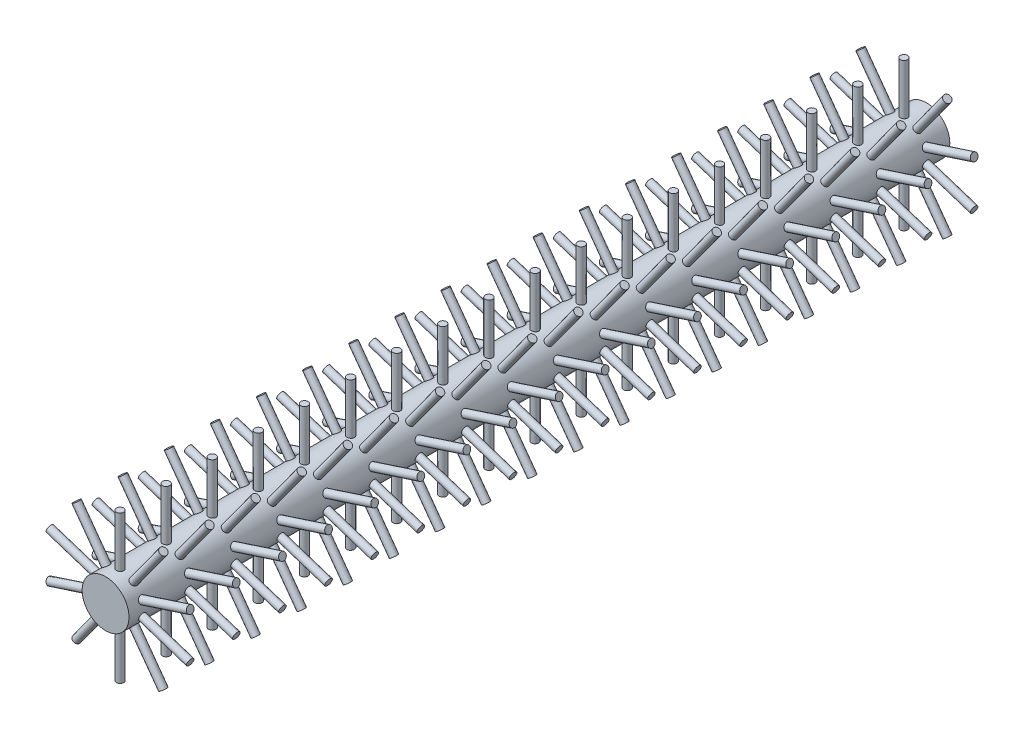
from build123d import *

# Parameters (mm, degrees)
SKETCH1_R                   = 12.7
BOSS_EXTRUDE1_DEPTH         = 445
SKETCH2_R                   = 2
BOSS_EXTRUDE2_DEPTH         = 40
CIRPATTERN1_COUNT           = 10
LPATTERN1_COPY_1_SKETCH_R   = 2
LPATTERN1_COPY_1_DEPTH      = 40
LPATTERN1_COPY_2_SKETCH_R   = 2
LPATTERN1_COPY_2_DEPTH      = 40
LPATTERN1_COPY_3_SKETCH_R   = 2
LPATTERN1_COPY_3_DEPTH      = 40
LPATTERN1_COPY_4_SKETCH_R   = 2
LPATTERN1_COPY_4_DEPTH      = 40
LPATTERN1_COPY_5_SKETCH_R   = 2
LPATTERN1_COPY_5_DEPTH      = 40
LPATTERN1_COPY_6_SKETCH_R   = 2
LPATTERN1_COPY_6_DEPTH      = 40
LPATTERN1_COPY_7_SKETCH_R   = 2
LPATTERN1_COPY_7_DEPTH      = 40
LPATTERN1_COPY_8_SKETCH_R   = 2
LPATTERN1_COPY_8_DEPTH      = 40
LPATTERN1_COPY_9_SKETCH_R   = 2
LPATTERN1_COPY_9_DEPTH      = 40
LPATTERN1_COPY_10_SKETCH_R  = 2
LPATTERN1_COPY_10_DEPTH     = 40
LPATTERN1_COPY_11_SKETCH_R  = 2
LPATTERN1_COPY_11_DEPTH     = 40
LPATTERN1_COPY_12_SKETCH_R  = 2
LPATTERN1_COPY_12_DEPTH     = 40
LPATTERN1_COPY_13_SKETCH_R  = 2
LPATTERN1_COPY_13_DEPTH     = 40
LPATTERN1_COPY_14_SKETCH_R  = 2
LPATTERN1_COPY_14_DEPTH     = 40
LPATTERN1_COPY_15_SKETCH_R  = 2
LPATTERN1_COPY_15_DEPTH     = 40
LPATTERN1_COPY_16_SKETCH_R  = 2
LPATTERN1_COPY_16_DEPTH     = 40
LPATTERN1_COPY_17_SKETCH_R  = 2
LPATTERN1_COPY_17_DEPTH     = 40
LPATTERN1_COPY_18_SKETCH_R  = 2
LPATTERN1_COPY_18_DEPTH     = 40
LPATTERN1_COPY_19_SKETCH_R  = 2
LPATTERN1_COPY_19_DEPTH     = 40
LPATTERN1_COPY_20_SKETCH_R  = 2
LPATTERN1_COPY_20_DEPTH     = 40
LPATTERN1_COPY_21_SKETCH_R  = 2
LPATTERN1_COPY_21_DEPTH     = 40
LPATTERN1_COPY_22_SKETCH_R  = 2
LPATTERN1_COPY_22_DEPTH     = 40
LPATTERN1_COPY_23_SKETCH_R  = 2
LPATTERN1_COPY_23_DEPTH     = 40
LPATTERN1_COPY_24_SKETCH_R  = 2
LPATTERN1_COPY_24_DEPTH     = 40
LPATTERN1_COPY_25_SKETCH_R  = 2
LPATTERN1_COPY_25_DEPTH     = 40
LPATTERN1_COPY_26_SKETCH_R  = 2
LPATTERN1_COPY_26_DEPTH     = 40
LPATTERN1_COPY_27_SKETCH_R  = 2
LPATTERN1_COPY_27_DEPTH     = 40
LPATTERN1_COPY_28_SKETCH_R  = 2
LPATTERN1_COPY_28_DEPTH     = 40
LPATTERN1_COPY_29_SKETCH_R  = 2
LPATTERN1_COPY_29_DEPTH     = 40
LPATTERN1_COPY_30_SKETCH_R  = 2
LPATTERN1_COPY_30_DEPTH     = 40
LPATTERN1_COPY_31_SKETCH_R  = 2
LPATTERN1_COPY_31_DEPTH     = 40
LPATTERN1_COPY_32_SKETCH_R  = 2
LPATTERN1_COPY_32_DEPTH     = 40
LPATTERN1_COPY_33_SKETCH_R  = 2
LPATTERN1_COPY_33_DEPTH     = 40
LPATTERN1_COPY_34_SKETCH_R  = 2
LPATTERN1_COPY_34_DEPTH     = 40
LPATTERN1_COPY_35_SKETCH_R  = 2
LPATTERN1_COPY_35_DEPTH     = 40
LPATTERN1_COPY_36_SKETCH_R  = 2
LPATTERN1_COPY_36_DEPTH     = 40
LPATTERN1_COPY_37_SKETCH_R  = 2
LPATTERN1_COPY_37_DEPTH     = 40
LPATTERN1_COPY_38_SKETCH_R  = 2
LPATTERN1_COPY_38_DEPTH     = 40
LPATTERN1_COPY_39_SKETCH_R  = 2
LPATTERN1_COPY_39_DEPTH     = 40
LPATTERN1_COPY_40_SKETCH_R  = 2
LPATTERN1_COPY_40_DEPTH     = 40
LPATTERN1_COPY_41_SKETCH_R  = 2
LPATTERN1_COPY_41_DEPTH     = 40
LPATTERN1_COPY_42_SKETCH_R  = 2
LPATTERN1_COPY_42_DEPTH     = 40
LPATTERN1_COPY_43_SKETCH_R  = 2
LPATTERN1_COPY_43_DEPTH     = 40
LPATTERN1_COPY_44_SKETCH_R  = 2
LPATTERN1_COPY_44_DEPTH     = 40
LPATTERN1_COPY_45_SKETCH_R  = 2
LPATTERN1_COPY_45_DEPTH     = 40
LPATTERN1_COPY_46_SKETCH_R  = 2
LPATTERN1_COPY_46_DEPTH     = 40
LPATTERN1_COPY_47_SKETCH_R  = 2
LPATTERN1_COPY_47_DEPTH     = 40
LPATTERN1_COPY_48_SKETCH_R  = 2
LPATTERN1_COPY_48_DEPTH     = 40
LPATTERN1_COPY_49_SKETCH_R  = 2
LPATTERN1_COPY_49_DEPTH     = 40
LPATTERN1_COPY_50_SKETCH_R  = 2
LPATTERN1_COPY_50_DEPTH     = 40
LPATTERN1_COPY_51_SKETCH_R  = 2
LPATTERN1_COPY_51_DEPTH     = 40
LPATTERN1_COPY_52_SKETCH_R  = 2
LPATTERN1_COPY_52_DEPTH     = 40
LPATTERN1_COPY_53_SKETCH_R  = 2
LPATTERN1_COPY_53_DEPTH     = 40
LPATTERN1_COPY_54_SKETCH_R  = 2
LPATTERN1_COPY_54_DEPTH     = 40
LPATTERN1_COPY_55_SKETCH_R  = 2
LPATTERN1_COPY_55_DEPTH     = 40
LPATTERN1_COPY_56_SKETCH_R  = 2
LPATTERN1_COPY_56_DEPTH     = 40
LPATTERN1_COPY_57_SKETCH_R  = 2
LPATTERN1_COPY_57_DEPTH     = 40
LPATTERN1_COPY_58_SKETCH_R  = 2
LPATTERN1_COPY_58_DEPTH     = 40
LPATTERN1_COPY_59_SKETCH_R  = 2
LPATTERN1_COPY_59_DEPTH     = 40
LPATTERN1_COPY_60_SKETCH_R  = 2
LPATTERN1_COPY_60_DEPTH     = 40
LPATTERN1_COPY_61_SKETCH_R  = 2
LPATTERN1_COPY_61_DEPTH     = 40
LPATTERN1_COPY_62_SKETCH_R  = 2
LPATTERN1_COPY_62_DEPTH     = 40
LPATTERN1_COPY_63_SKETCH_R  = 2
LPATTERN1_COPY_63_DEPTH     = 40
LPATTERN1_COPY_64_SKETCH_R  = 2
LPATTERN1_COPY_64_DEPTH     = 40
LPATTERN1_COPY_65_SKETCH_R  = 2
LPATTERN1_COPY_65_DEPTH     = 40
LPATTERN1_COPY_66_SKETCH_R  = 2
LPATTERN1_COPY_66_DEPTH     = 40
LPATTERN1_COPY_67_SKETCH_R  = 2
LPATTERN1_COPY_67_DEPTH     = 40
LPATTERN1_COPY_68_SKETCH_R  = 2
LPATTERN1_COPY_68_DEPTH     = 40
LPATTERN1_COPY_69_SKETCH_R  = 2
LPATTERN1_COPY_69_DEPTH     = 40
LPATTERN1_COPY_70_SKETCH_R  = 2
LPATTERN1_COPY_70_DEPTH     = 40
LPATTERN1_COPY_71_SKETCH_R  = 2
LPATTERN1_COPY_71_DEPTH     = 40
LPATTERN1_COPY_72_SKETCH_R  = 2
LPATTERN1_COPY_72_DEPTH     = 40
LPATTERN1_COPY_73_SKETCH_R  = 2
LPATTERN1_COPY_73_DEPTH     = 40
LPATTERN1_COPY_74_SKETCH_R  = 2
LPATTERN1_COPY_74_DEPTH     = 40
LPATTERN1_COPY_75_SKETCH_R  = 2
LPATTERN1_COPY_75_DEPTH     = 40
LPATTERN1_COPY_76_SKETCH_R  = 2
LPATTERN1_COPY_76_DEPTH     = 40
LPATTERN1_COPY_77_SKETCH_R  = 2
LPATTERN1_COPY_77_DEPTH     = 40
LPATTERN1_COPY_78_SKETCH_R  = 2
LPATTERN1_COPY_78_DEPTH     = 40
LPATTERN1_COPY_79_SKETCH_R  = 2
LPATTERN1_COPY_79_DEPTH     = 40
LPATTERN1_COPY_80_SKETCH_R  = 2
LPATTERN1_COPY_80_DEPTH     = 40
LPATTERN1_COPY_81_SKETCH_R  = 2
LPATTERN1_COPY_81_DEPTH     = 40
LPATTERN1_COPY_82_SKETCH_R  = 2
LPATTERN1_COPY_82_DEPTH     = 40
LPATTERN1_COPY_83_SKETCH_R  = 2
LPATTERN1_COPY_83_DEPTH     = 40
LPATTERN1_COPY_84_SKETCH_R  = 2
LPATTERN1_COPY_84_DEPTH     = 40
LPATTERN1_COPY_85_SKETCH_R  = 2
LPATTERN1_COPY_85_DEPTH     = 40
LPATTERN1_COPY_86_SKETCH_R  = 2
LPATTERN1_COPY_86_DEPTH     = 40
LPATTERN1_COPY_87_SKETCH_R  = 2
LPATTERN1_COPY_87_DEPTH     = 40
LPATTERN1_COPY_88_SKETCH_R  = 2
LPATTERN1_COPY_88_DEPTH     = 40
LPATTERN1_COPY_89_SKETCH_R  = 2
LPATTERN1_COPY_89_DEPTH     = 40
LPATTERN1_COPY_90_SKETCH_R  = 2
LPATTERN1_COPY_90_DEPTH     = 40
LPATTERN1_COPY_91_SKETCH_R  = 2
LPATTERN1_COPY_91_DEPTH     = 40
LPATTERN1_COPY_92_SKETCH_R  = 2
LPATTERN1_COPY_92_DEPTH     = 40
LPATTERN1_COPY_93_SKETCH_R  = 2
LPATTERN1_COPY_93_DEPTH     = 40
LPATTERN1_COPY_94_SKETCH_R  = 2
LPATTERN1_COPY_94_DEPTH     = 40
LPATTERN1_COPY_95_SKETCH_R  = 2
LPATTERN1_COPY_95_DEPTH     = 40
LPATTERN1_COPY_96_SKETCH_R  = 2
LPATTERN1_COPY_96_DEPTH     = 40
LPATTERN1_COPY_97_SKETCH_R  = 2
LPATTERN1_COPY_97_DEPTH     = 40
LPATTERN1_COPY_98_SKETCH_R  = 2
LPATTERN1_COPY_98_DEPTH     = 40
LPATTERN1_COPY_99_SKETCH_R  = 2
LPATTERN1_COPY_99_DEPTH     = 40
LPATTERN1_COPY_100_SKETCH_R = 2
LPATTERN1_COPY_100_DEPTH    = 40
LPATTERN1_COPY_101_SKETCH_R = 2
LPATTERN1_COPY_101_DEPTH    = 40
LPATTERN1_COPY_102_SKETCH_R = 2
LPATTERN1_COPY_102_DEPTH    = 40
LPATTERN1_COPY_103_SKETCH_R = 2
LPATTERN1_COPY_103_DEPTH    = 40
LPATTERN1_COPY_104_SKETCH_R = 2
LPATTERN1_COPY_104_DEPTH    = 40
LPATTERN1_COPY_105_SKETCH_R = 2
LPATTERN1_COPY_105_DEPTH    = 40
LPATTERN1_COPY_106_SKETCH_R = 2
LPATTERN1_COPY_106_DEPTH    = 40
LPATTERN1_COPY_107_SKETCH_R = 2
LPATTERN1_COPY_107_DEPTH    = 40
LPATTERN1_COPY_108_SKETCH_R = 2
LPATTERN1_COPY_108_DEPTH    = 40
LPATTERN1_COPY_109_SKETCH_R = 2
LPATTERN1_COPY_109_DEPTH    = 40
LPATTERN1_COPY_110_SKETCH_R = 2
LPATTERN1_COPY_110_DEPTH    = 40
LPATTERN1_COPY_111_SKETCH_R = 2
LPATTERN1_COPY_111_DEPTH    = 40
LPATTERN1_COPY_112_SKETCH_R = 2
LPATTERN1_COPY_112_DEPTH    = 40
LPATTERN1_COPY_113_SKETCH_R = 2
LPATTERN1_COPY_113_DEPTH    = 40
LPATTERN1_COPY_114_SKETCH_R = 2
LPATTERN1_COPY_114_DEPTH    = 40
LPATTERN1_COPY_115_SKETCH_R = 2
LPATTERN1_COPY_115_DEPTH    = 40
LPATTERN1_COPY_116_SKETCH_R = 2
LPATTERN1_COPY_116_DEPTH    = 40
LPATTERN1_COPY_117_SKETCH_R = 2
LPATTERN1_COPY_117_DEPTH    = 40
LPATTERN1_COPY_118_SKETCH_R = 2
LPATTERN1_COPY_118_DEPTH    = 40
LPATTERN1_COPY_119_SKETCH_R = 2
LPATTERN1_COPY_119_DEPTH    = 40
LPATTERN1_COPY_120_SKETCH_R = 2
LPATTERN1_COPY_120_DEPTH    = 40
LPATTERN1_COPY_121_SKETCH_R = 2
LPATTERN1_COPY_121_DEPTH    = 40
LPATTERN1_COPY_122_SKETCH_R = 2
LPATTERN1_COPY_122_DEPTH    = 40
LPATTERN1_COPY_123_SKETCH_R = 2
LPATTERN1_COPY_123_DEPTH    = 40
LPATTERN1_COPY_124_SKETCH_R = 2
LPATTERN1_COPY_124_DEPTH    = 40
LPATTERN1_COPY_125_SKETCH_R = 2
LPATTERN1_COPY_125_DEPTH    = 40
LPATTERN1_COPY_126_SKETCH_R = 2
LPATTERN1_COPY_126_DEPTH    = 40
LPATTERN1_COPY_127_SKETCH_R = 2
LPATTERN1_COPY_127_DEPTH    = 40
LPATTERN1_COPY_128_SKETCH_R = 2
LPATTERN1_COPY_128_DEPTH    = 40
LPATTERN1_COPY_129_SKETCH_R = 2
LPATTERN1_COPY_129_DEPTH    = 40
LPATTERN1_COPY_130_SKETCH_R = 2
LPATTERN1_COPY_130_DEPTH    = 40
LPATTERN1_COPY_131_SKETCH_R = 2
LPATTERN1_COPY_131_DEPTH    = 40
LPATTERN1_COPY_132_SKETCH_R = 2
LPATTERN1_COPY_132_DEPTH    = 40
LPATTERN1_COPY_133_SKETCH_R = 2
LPATTERN1_COPY_133_DEPTH    = 40
LPATTERN1_COPY_134_SKETCH_R = 2
LPATTERN1_COPY_134_DEPTH    = 40
LPATTERN1_COPY_135_SKETCH_R = 2
LPATTERN1_COPY_135_DEPTH    = 40
LPATTERN1_COPY_136_SKETCH_R = 2
LPATTERN1_COPY_136_DEPTH    = 40
LPATTERN1_COPY_137_SKETCH_R = 2
LPATTERN1_COPY_137_DEPTH    = 40
LPATTERN1_COPY_138_SKETCH_R = 2
LPATTERN1_COPY_138_DEPTH    = 40
LPATTERN1_COPY_139_SKETCH_R = 2
LPATTERN1_COPY_139_DEPTH    = 40
LPATTERN1_COPY_140_SKETCH_R = 2
LPATTERN1_COPY_140_DEPTH    = 40
LPATTERN1_COPY_141_SKETCH_R = 2
LPATTERN1_COPY_141_DEPTH    = 40
LPATTERN1_COPY_142_SKETCH_R = 2
LPATTERN1_COPY_142_DEPTH    = 40
LPATTERN1_COPY_143_SKETCH_R = 2
LPATTERN1_COPY_143_DEPTH    = 40
LPATTERN1_COPY_144_SKETCH_R = 2
LPATTERN1_COPY_144_DEPTH    = 40
LPATTERN1_COPY_145_SKETCH_R = 2
LPATTERN1_COPY_145_DEPTH    = 40
LPATTERN1_COPY_146_SKETCH_R = 2
LPATTERN1_COPY_146_DEPTH    = 40
LPATTERN1_COPY_147_SKETCH_R = 2
LPATTERN1_COPY_147_DEPTH    = 40
LPATTERN1_COPY_148_SKETCH_R = 2
LPATTERN1_COPY_148_DEPTH    = 40
LPATTERN1_COPY_149_SKETCH_R = 2
LPATTERN1_COPY_149_DEPTH    = 40
LPATTERN1_COPY_150_SKETCH_R = 2
LPATTERN1_COPY_150_DEPTH    = 40
LPATTERN1_COPY_151_SKETCH_R = 2
LPATTERN1_COPY_151_DEPTH    = 40
LPATTERN1_COPY_152_SKETCH_R = 2
LPATTERN1_COPY_152_DEPTH    = 40
LPATTERN1_COPY_153_SKETCH_R = 2
LPATTERN1_COPY_153_DEPTH    = 40
LPATTERN1_COPY_154_SKETCH_R = 2
LPATTERN1_COPY_154_DEPTH    = 40
LPATTERN1_COPY_155_SKETCH_R = 2
LPATTERN1_COPY_155_DEPTH    = 40
LPATTERN1_COPY_156_SKETCH_R = 2
LPATTERN1_COPY_156_DEPTH    = 40
LPATTERN1_COPY_157_SKETCH_R = 2
LPATTERN1_COPY_157_DEPTH    = 40
LPATTERN1_COPY_158_SKETCH_R = 2
LPATTERN1_COPY_158_DEPTH    = 40
LPATTERN1_COPY_159_SKETCH_R = 2
LPATTERN1_COPY_159_DEPTH    = 40
LPATTERN1_COPY_160_SKETCH_R = 2
LPATTERN1_COPY_160_DEPTH    = 40
LPATTERN1_COPY_161_SKETCH_R = 2
LPATTERN1_COPY_161_DEPTH    = 40
LPATTERN1_COPY_162_SKETCH_R = 2
LPATTERN1_COPY_162_DEPTH    = 40
LPATTERN1_COPY_163_SKETCH_R = 2
LPATTERN1_COPY_163_DEPTH    = 40
LPATTERN1_COPY_164_SKETCH_R = 2
LPATTERN1_COPY_164_DEPTH    = 40
LPATTERN1_COPY_165_SKETCH_R = 2
LPATTERN1_COPY_165_DEPTH    = 40
LPATTERN1_COPY_166_SKETCH_R = 2
LPATTERN1_COPY_166_DEPTH    = 40
LPATTERN1_COPY_167_SKETCH_R = 2
LPATTERN1_COPY_167_DEPTH    = 40
LPATTERN1_COPY_168_SKETCH_R = 2
LPATTERN1_COPY_168_DEPTH    = 40
LPATTERN1_COPY_169_SKETCH_R = 2
LPATTERN1_COPY_169_DEPTH    = 40
LPATTERN1_COPY_170_SKETCH_R = 2
LPATTERN1_COPY_170_DEPTH    = 40


with BuildPart() as part:
    # Sketch1 → Boss-Extrude1 (new body)
    with BuildSketch(Plane.XY):
        Circle(SKETCH1_R)
    extrude(amount=BOSS_EXTRUDE1_DEPTH)

    # Sketch2 → Boss-Extrude2 (add)
    with BuildSketch(Plane(origin=(0, 0, 0), x_dir=(1, 0, 0), z_dir=(0, 1, 0))):
        with Locations((0, -12.157583122)):
            Circle(SKETCH2_R)
    boss_extrude2 = extrude(amount=BOSS_EXTRUDE2_DEPTH)

    # CirPattern1: Boss-Extrude2 ×10 about axis
    cirpattern1_axis = Axis((0, 0, 445), (0, 0, -1))
    for i in range(1, CIRPATTERN1_COUNT):
        add(boss_extrude2.rotate(cirpattern1_axis, i * 360 / CIRPATTERN1_COUNT))

    # LPattern1 copy 1 sketch → LPattern1 copy 1 (add)
    with BuildSketch(Plane(origin=(0, 0, 25), x_dir=(0.8090169943749475, -0.5877852522924731, 0), z_dir=(0.5877852522924731, 0.8090169943749475, 0))):
        with Locations((0, -12.157583122)):
            Circle(LPATTERN1_COPY_1_SKETCH_R)
    extrude(amount=LPATTERN1_COPY_1_DEPTH)

    # LPattern1 copy 2 sketch → LPattern1 copy 2 (add)
    with BuildSketch(Plane(origin=(0, 0, 50), x_dir=(0.8090169943749475, -0.5877852522924731, 0), z_dir=(0.5877852522924731, 0.8090169943749475, 0))):
        with Locations((0, -12.157583122)):
            Circle(LPATTERN1_COPY_2_SKETCH_R)
    extrude(amount=LPATTERN1_COPY_2_DEPTH)

    # LPattern1 copy 3 sketch → LPattern1 copy 3 (add)
    with BuildSketch(Plane(origin=(0, 0, 75), x_dir=(0.8090169943749475, -0.5877852522924731, 0), z_dir=(0.5877852522924731, 0.8090169943749475, 0))):
        with Locations((0, -12.157583122)):
            Circle(LPATTERN1_COPY_3_SKETCH_R)
    extrude(amount=LPATTERN1_COPY_3_DEPTH)

    # LPattern1 copy 4 sketch → LPattern1 copy 4 (add)
    with BuildSketch(Plane(origin=(0, 0, 100), x_dir=(0.8090169943749475, -0.5877852522924731, 0), z_dir=(0.5877852522924731, 0.8090169943749475, 0))):
        with Locations((0, -12.157583122)):
            Circle(LPATTERN1_COPY_4_SKETCH_R)
    extrude(amount=LPATTERN1_COPY_4_DEPTH)

    # LPattern1 copy 5 sketch → LPattern1 copy 5 (add)
    with BuildSketch(Plane(origin=(0, 0, 125), x_dir=(0.8090169943749475, -0.5877852522924731, 0), z_dir=(0.5877852522924731, 0.8090169943749475, 0))):
        with Locations((0, -12.157583122)):
            Circle(LPATTERN1_COPY_5_SKETCH_R)
    extrude(amount=LPATTERN1_COPY_5_DEPTH)

    # LPattern1 copy 6 sketch → LPattern1 copy 6 (add)
    with BuildSketch(Plane(origin=(0, 0, 150), x_dir=(0.8090169943749475, -0.5877852522924731, 0), z_dir=(0.5877852522924731, 0.8090169943749475, 0))):
        with Locations((0, -12.157583122)):
            Circle(LPATTERN1_COPY_6_SKETCH_R)
    extrude(amount=LPATTERN1_COPY_6_DEPTH)

    # LPattern1 copy 7 sketch → LPattern1 copy 7 (add)
    with BuildSketch(Plane(origin=(0, 0, 175), x_dir=(0.8090169943749475, -0.5877852522924731, 0), z_dir=(0.5877852522924731, 0.8090169943749475, 0))):
        with Locations((0, -12.157583122)):
            Circle(LPATTERN1_COPY_7_SKETCH_R)
    extrude(amount=LPATTERN1_COPY_7_DEPTH)

    # LPattern1 copy 8 sketch → LPattern1 copy 8 (add)
    with BuildSketch(Plane(origin=(0, 0, 200), x_dir=(0.8090169943749475, -0.5877852522924731, 0), z_dir=(0.5877852522924731, 0.8090169943749475, 0))):
        with Locations((0, -12.157583122)):
            Circle(LPATTERN1_COPY_8_SKETCH_R)
    extrude(amount=LPATTERN1_COPY_8_DEPTH)

    # LPattern1 copy 9 sketch → LPattern1 copy 9 (add)
    with BuildSketch(Plane(origin=(0, 0, 225), x_dir=(0.8090169943749475, -0.5877852522924731, 0), z_dir=(0.5877852522924731, 0.8090169943749475, 0))):
        with Locations((0, -12.157583122)):
            Circle(LPATTERN1_COPY_9_SKETCH_R)
    extrude(amount=LPATTERN1_COPY_9_DEPTH)

    # LPattern1 copy 10 sketch → LPattern1 copy 10 (add)
    with BuildSketch(Plane(origin=(0, 0, 250), x_dir=(0.8090169943749475, -0.5877852522924731, 0), z_dir=(0.5877852522924731, 0.8090169943749475, 0))):
        with Locations((0, -12.157583122)):
            Circle(LPATTERN1_COPY_10_SKETCH_R)
    extrude(amount=LPATTERN1_COPY_10_DEPTH)

    # LPattern1 copy 11 sketch → LPattern1 copy 11 (add)
    with BuildSketch(Plane(origin=(0, 0, 275), x_dir=(0.8090169943749475, -0.5877852522924731, 0), z_dir=(0.5877852522924731, 0.8090169943749475, 0))):
        with Locations((0, -12.157583122)):
            Circle(LPATTERN1_COPY_11_SKETCH_R)
    extrude(amount=LPATTERN1_COPY_11_DEPTH)

    # LPattern1 copy 12 sketch → LPattern1 copy 12 (add)
    with BuildSketch(Plane(origin=(0, 0, 300), x_dir=(0.8090169943749475, -0.5877852522924731, 0), z_dir=(0.5877852522924731, 0.8090169943749475, 0))):
        with Locations((0, -12.157583122)):
            Circle(LPATTERN1_COPY_12_SKETCH_R)
    extrude(amount=LPATTERN1_COPY_12_DEPTH)

    # LPattern1 copy 13 sketch → LPattern1 copy 13 (add)
    with BuildSketch(Plane(origin=(0, 0, 325), x_dir=(0.8090169943749475, -0.5877852522924731, 0), z_dir=(0.5877852522924731, 0.8090169943749475, 0))):
        with Locations((0, -12.157583122)):
            Circle(LPATTERN1_COPY_13_SKETCH_R)
    extrude(amount=LPATTERN1_COPY_13_DEPTH)

    # LPattern1 copy 14 sketch → LPattern1 copy 14 (add)
    with BuildSketch(Plane(origin=(0, 0, 350), x_dir=(0.8090169943749475, -0.5877852522924731, 0), z_dir=(0.5877852522924731, 0.8090169943749475, 0))):
        with Locations((0, -12.157583122)):
            Circle(LPATTERN1_COPY_14_SKETCH_R)
    extrude(amount=LPATTERN1_COPY_14_DEPTH)

    # LPattern1 copy 15 sketch → LPattern1 copy 15 (add)
    with BuildSketch(Plane(origin=(0, 0, 375), x_dir=(0.8090169943749475, -0.5877852522924731, 0), z_dir=(0.5877852522924731, 0.8090169943749475, 0))):
        with Locations((0, -12.157583122)):
            Circle(LPATTERN1_COPY_15_SKETCH_R)
    extrude(amount=LPATTERN1_COPY_15_DEPTH)

    # LPattern1 copy 16 sketch → LPattern1 copy 16 (add)
    with BuildSketch(Plane(origin=(0, 0, 400), x_dir=(0.8090169943749475, -0.5877852522924731, 0), z_dir=(0.5877852522924731, 0.8090169943749475, 0))):
        with Locations((0, -12.157583122)):
            Circle(LPATTERN1_COPY_16_SKETCH_R)
    extrude(amount=LPATTERN1_COPY_16_DEPTH)

    # LPattern1 copy 17 sketch → LPattern1 copy 17 (add)
    with BuildSketch(Plane(origin=(0, 0, 425), x_dir=(0.8090169943749475, -0.5877852522924731, 0), z_dir=(0.5877852522924731, 0.8090169943749475, 0))):
        with Locations((0, -12.157583122)):
            Circle(LPATTERN1_COPY_17_SKETCH_R)
    extrude(amount=LPATTERN1_COPY_17_DEPTH)

    # LPattern1 copy 18 sketch → LPattern1 copy 18 (add)
    with BuildSketch(Plane(origin=(0, 0, 25), x_dir=(0.30901699437494745, -0.9510565162951535, 0), z_dir=(0.9510565162951535, 0.30901699437494745, 0))):
        with Locations((0, -12.157583122)):
            Circle(LPATTERN1_COPY_18_SKETCH_R)
    extrude(amount=LPATTERN1_COPY_18_DEPTH)

    # LPattern1 copy 19 sketch → LPattern1 copy 19 (add)
    with BuildSketch(Plane(origin=(0, 0, 50), x_dir=(0.30901699437494745, -0.9510565162951535, 0), z_dir=(0.9510565162951535, 0.30901699437494745, 0))):
        with Locations((0, -12.157583122)):
            Circle(LPATTERN1_COPY_19_SKETCH_R)
    extrude(amount=LPATTERN1_COPY_19_DEPTH)

    # LPattern1 copy 20 sketch → LPattern1 copy 20 (add)
    with BuildSketch(Plane(origin=(0, 0, 75), x_dir=(0.30901699437494745, -0.9510565162951535, 0), z_dir=(0.9510565162951535, 0.30901699437494745, 0))):
        with Locations((0, -12.157583122)):
            Circle(LPATTERN1_COPY_20_SKETCH_R)
    extrude(amount=LPATTERN1_COPY_20_DEPTH)

    # LPattern1 copy 21 sketch → LPattern1 copy 21 (add)
    with BuildSketch(Plane(origin=(0, 0, 100), x_dir=(0.30901699437494745, -0.9510565162951535, 0), z_dir=(0.9510565162951535, 0.30901699437494745, 0))):
        with Locations((0, -12.157583122)):
            Circle(LPATTERN1_COPY_21_SKETCH_R)
    extrude(amount=LPATTERN1_COPY_21_DEPTH)

    # LPattern1 copy 22 sketch → LPattern1 copy 22 (add)
    with BuildSketch(Plane(origin=(0, 0, 125), x_dir=(0.30901699437494745, -0.9510565162951535, 0), z_dir=(0.9510565162951535, 0.30901699437494745, 0))):
        with Locations((0, -12.157583122)):
            Circle(LPATTERN1_COPY_22_SKETCH_R)
    extrude(amount=LPATTERN1_COPY_22_DEPTH)

    # LPattern1 copy 23 sketch → LPattern1 copy 23 (add)
    with BuildSketch(Plane(origin=(0, 0, 150), x_dir=(0.30901699437494745, -0.9510565162951535, 0), z_dir=(0.9510565162951535, 0.30901699437494745, 0))):
        with Locations((0, -12.157583122)):
            Circle(LPATTERN1_COPY_23_SKETCH_R)
    extrude(amount=LPATTERN1_COPY_23_DEPTH)

    # LPattern1 copy 24 sketch → LPattern1 copy 24 (add)
    with BuildSketch(Plane(origin=(0, 0, 175), x_dir=(0.30901699437494745, -0.9510565162951535, 0), z_dir=(0.9510565162951535, 0.30901699437494745, 0))):
        with Locations((0, -12.157583122)):
            Circle(LPATTERN1_COPY_24_SKETCH_R)
    extrude(amount=LPATTERN1_COPY_24_DEPTH)

    # LPattern1 copy 25 sketch → LPattern1 copy 25 (add)
    with BuildSketch(Plane(origin=(0, 0, 200), x_dir=(0.30901699437494745, -0.9510565162951535, 0), z_dir=(0.9510565162951535, 0.30901699437494745, 0))):
        with Locations((0, -12.157583122)):
            Circle(LPATTERN1_COPY_25_SKETCH_R)
    extrude(amount=LPATTERN1_COPY_25_DEPTH)

    # LPattern1 copy 26 sketch → LPattern1 copy 26 (add)
    with BuildSketch(Plane(origin=(0, 0, 225), x_dir=(0.30901699437494745, -0.9510565162951535, 0), z_dir=(0.9510565162951535, 0.30901699437494745, 0))):
        with Locations((0, -12.157583122)):
            Circle(LPATTERN1_COPY_26_SKETCH_R)
    extrude(amount=LPATTERN1_COPY_26_DEPTH)

    # LPattern1 copy 27 sketch → LPattern1 copy 27 (add)
    with BuildSketch(Plane(origin=(0, 0, 250), x_dir=(0.30901699437494745, -0.9510565162951535, 0), z_dir=(0.9510565162951535, 0.30901699437494745, 0))):
        with Locations((0, -12.157583122)):
            Circle(LPATTERN1_COPY_27_SKETCH_R)
    extrude(amount=LPATTERN1_COPY_27_DEPTH)

    # LPattern1 copy 28 sketch → LPattern1 copy 28 (add)
    with BuildSketch(Plane(origin=(0, 0, 275), x_dir=(0.30901699437494745, -0.9510565162951535, 0), z_dir=(0.9510565162951535, 0.30901699437494745, 0))):
        with Locations((0, -12.157583122)):
            Circle(LPATTERN1_COPY_28_SKETCH_R)
    extrude(amount=LPATTERN1_COPY_28_DEPTH)

    # LPattern1 copy 29 sketch → LPattern1 copy 29 (add)
    with BuildSketch(Plane(origin=(0, 0, 300), x_dir=(0.30901699437494745, -0.9510565162951535, 0), z_dir=(0.9510565162951535, 0.30901699437494745, 0))):
        with Locations((0, -12.157583122)):
            Circle(LPATTERN1_COPY_29_SKETCH_R)
    extrude(amount=LPATTERN1_COPY_29_DEPTH)

    # LPattern1 copy 30 sketch → LPattern1 copy 30 (add)
    with BuildSketch(Plane(origin=(0, 0, 325), x_dir=(0.30901699437494745, -0.9510565162951535, 0), z_dir=(0.9510565162951535, 0.30901699437494745, 0))):
        with Locations((0, -12.157583122)):
            Circle(LPATTERN1_COPY_30_SKETCH_R)
    extrude(amount=LPATTERN1_COPY_30_DEPTH)

    # LPattern1 copy 31 sketch → LPattern1 copy 31 (add)
    with BuildSketch(Plane(origin=(0, 0, 350), x_dir=(0.30901699437494745, -0.9510565162951535, 0), z_dir=(0.9510565162951535, 0.30901699437494745, 0))):
        with Locations((0, -12.157583122)):
            Circle(LPATTERN1_COPY_31_SKETCH_R)
    extrude(amount=LPATTERN1_COPY_31_DEPTH)

    # LPattern1 copy 32 sketch → LPattern1 copy 32 (add)
    with BuildSketch(Plane(origin=(0, 0, 375), x_dir=(0.30901699437494745, -0.9510565162951535, 0), z_dir=(0.9510565162951535, 0.30901699437494745, 0))):
        with Locations((0, -12.157583122)):
            Circle(LPATTERN1_COPY_32_SKETCH_R)
    extrude(amount=LPATTERN1_COPY_32_DEPTH)

    # LPattern1 copy 33 sketch → LPattern1 copy 33 (add)
    with BuildSketch(Plane(origin=(0, 0, 400), x_dir=(0.30901699437494745, -0.9510565162951535, 0), z_dir=(0.9510565162951535, 0.30901699437494745, 0))):
        with Locations((0, -12.157583122)):
            Circle(LPATTERN1_COPY_33_SKETCH_R)
    extrude(amount=LPATTERN1_COPY_33_DEPTH)

    # LPattern1 copy 34 sketch → LPattern1 copy 34 (add)
    with BuildSketch(Plane(origin=(0, 0, 425), x_dir=(0.30901699437494745, -0.9510565162951535, 0), z_dir=(0.9510565162951535, 0.30901699437494745, 0))):
        with Locations((0, -12.157583122)):
            Circle(LPATTERN1_COPY_34_SKETCH_R)
    extrude(amount=LPATTERN1_COPY_34_DEPTH)

    # LPattern1 copy 35 sketch → LPattern1 copy 35 (add)
    with BuildSketch(Plane(origin=(0, 0, 25), x_dir=(-0.30901699437494734, -0.9510565162951536, 0), z_dir=(0.9510565162951536, -0.30901699437494734, 0))):
        with Locations((0, -12.157583122)):
            Circle(LPATTERN1_COPY_35_SKETCH_R)
    extrude(amount=LPATTERN1_COPY_35_DEPTH)

    # LPattern1 copy 36 sketch → LPattern1 copy 36 (add)
    with BuildSketch(Plane(origin=(0, 0, 50), x_dir=(-0.30901699437494734, -0.9510565162951536, 0), z_dir=(0.9510565162951536, -0.30901699437494734, 0))):
        with Locations((0, -12.157583122)):
            Circle(LPATTERN1_COPY_36_SKETCH_R)
    extrude(amount=LPATTERN1_COPY_36_DEPTH)

    # LPattern1 copy 37 sketch → LPattern1 copy 37 (add)
    with BuildSketch(Plane(origin=(0, 0, 75), x_dir=(-0.30901699437494734, -0.9510565162951536, 0), z_dir=(0.9510565162951536, -0.30901699437494734, 0))):
        with Locations((0, -12.157583122)):
            Circle(LPATTERN1_COPY_37_SKETCH_R)
    extrude(amount=LPATTERN1_COPY_37_DEPTH)

    # LPattern1 copy 38 sketch → LPattern1 copy 38 (add)
    with BuildSketch(Plane(origin=(0, 0, 100), x_dir=(-0.30901699437494734, -0.9510565162951536, 0), z_dir=(0.9510565162951536, -0.30901699437494734, 0))):
        with Locations((0, -12.157583122)):
            Circle(LPATTERN1_COPY_38_SKETCH_R)
    extrude(amount=LPATTERN1_COPY_38_DEPTH)

    # LPattern1 copy 39 sketch → LPattern1 copy 39 (add)
    with BuildSketch(Plane(origin=(0, 0, 125), x_dir=(-0.30901699437494734, -0.9510565162951536, 0), z_dir=(0.9510565162951536, -0.30901699437494734, 0))):
        with Locations((0, -12.157583122)):
            Circle(LPATTERN1_COPY_39_SKETCH_R)
    extrude(amount=LPATTERN1_COPY_39_DEPTH)

    # LPattern1 copy 40 sketch → LPattern1 copy 40 (add)
    with BuildSketch(Plane(origin=(0, 0, 150), x_dir=(-0.30901699437494734, -0.9510565162951536, 0), z_dir=(0.9510565162951536, -0.30901699437494734, 0))):
        with Locations((0, -12.157583122)):
            Circle(LPATTERN1_COPY_40_SKETCH_R)
    extrude(amount=LPATTERN1_COPY_40_DEPTH)

    # LPattern1 copy 41 sketch → LPattern1 copy 41 (add)
    with BuildSketch(Plane(origin=(0, 0, 175), x_dir=(-0.30901699437494734, -0.9510565162951536, 0), z_dir=(0.9510565162951536, -0.30901699437494734, 0))):
        with Locations((0, -12.157583122)):
            Circle(LPATTERN1_COPY_41_SKETCH_R)
    extrude(amount=LPATTERN1_COPY_41_DEPTH)

    # LPattern1 copy 42 sketch → LPattern1 copy 42 (add)
    with BuildSketch(Plane(origin=(0, 0, 200), x_dir=(-0.30901699437494734, -0.9510565162951536, 0), z_dir=(0.9510565162951536, -0.30901699437494734, 0))):
        with Locations((0, -12.157583122)):
            Circle(LPATTERN1_COPY_42_SKETCH_R)
    extrude(amount=LPATTERN1_COPY_42_DEPTH)

    # LPattern1 copy 43 sketch → LPattern1 copy 43 (add)
    with BuildSketch(Plane(origin=(0, 0, 225), x_dir=(-0.30901699437494734, -0.9510565162951536, 0), z_dir=(0.9510565162951536, -0.30901699437494734, 0))):
        with Locations((0, -12.157583122)):
            Circle(LPATTERN1_COPY_43_SKETCH_R)
    extrude(amount=LPATTERN1_COPY_43_DEPTH)

    # LPattern1 copy 44 sketch → LPattern1 copy 44 (add)
    with BuildSketch(Plane(origin=(0, 0, 250), x_dir=(-0.30901699437494734, -0.9510565162951536, 0), z_dir=(0.9510565162951536, -0.30901699437494734, 0))):
        with Locations((0, -12.157583122)):
            Circle(LPATTERN1_COPY_44_SKETCH_R)
    extrude(amount=LPATTERN1_COPY_44_DEPTH)

    # LPattern1 copy 45 sketch → LPattern1 copy 45 (add)
    with BuildSketch(Plane(origin=(0, 0, 275), x_dir=(-0.30901699437494734, -0.9510565162951536, 0), z_dir=(0.9510565162951536, -0.30901699437494734, 0))):
        with Locations((0, -12.157583122)):
            Circle(LPATTERN1_COPY_45_SKETCH_R)
    extrude(amount=LPATTERN1_COPY_45_DEPTH)

    # LPattern1 copy 46 sketch → LPattern1 copy 46 (add)
    with BuildSketch(Plane(origin=(0, 0, 300), x_dir=(-0.30901699437494734, -0.9510565162951536, 0), z_dir=(0.9510565162951536, -0.30901699437494734, 0))):
        with Locations((0, -12.157583122)):
            Circle(LPATTERN1_COPY_46_SKETCH_R)
    extrude(amount=LPATTERN1_COPY_46_DEPTH)

    # LPattern1 copy 47 sketch → LPattern1 copy 47 (add)
    with BuildSketch(Plane(origin=(0, 0, 325), x_dir=(-0.30901699437494734, -0.9510565162951536, 0), z_dir=(0.9510565162951536, -0.30901699437494734, 0))):
        with Locations((0, -12.157583122)):
            Circle(LPATTERN1_COPY_47_SKETCH_R)
    extrude(amount=LPATTERN1_COPY_47_DEPTH)

    # LPattern1 copy 48 sketch → LPattern1 copy 48 (add)
    with BuildSketch(Plane(origin=(0, 0, 350), x_dir=(-0.30901699437494734, -0.9510565162951536, 0), z_dir=(0.9510565162951536, -0.30901699437494734, 0))):
        with Locations((0, -12.157583122)):
            Circle(LPATTERN1_COPY_48_SKETCH_R)
    extrude(amount=LPATTERN1_COPY_48_DEPTH)

    # LPattern1 copy 49 sketch → LPattern1 copy 49 (add)
    with BuildSketch(Plane(origin=(0, 0, 375), x_dir=(-0.30901699437494734, -0.9510565162951536, 0), z_dir=(0.9510565162951536, -0.30901699437494734, 0))):
        with Locations((0, -12.157583122)):
            Circle(LPATTERN1_COPY_49_SKETCH_R)
    extrude(amount=LPATTERN1_COPY_49_DEPTH)

    # LPattern1 copy 50 sketch → LPattern1 copy 50 (add)
    with BuildSketch(Plane(origin=(0, 0, 400), x_dir=(-0.30901699437494734, -0.9510565162951536, 0), z_dir=(0.9510565162951536, -0.30901699437494734, 0))):
        with Locations((0, -12.157583122)):
            Circle(LPATTERN1_COPY_50_SKETCH_R)
    extrude(amount=LPATTERN1_COPY_50_DEPTH)

    # LPattern1 copy 51 sketch → LPattern1 copy 51 (add)
    with BuildSketch(Plane(origin=(0, 0, 425), x_dir=(-0.30901699437494734, -0.9510565162951536, 0), z_dir=(0.9510565162951536, -0.30901699437494734, 0))):
        with Locations((0, -12.157583122)):
            Circle(LPATTERN1_COPY_51_SKETCH_R)
    extrude(amount=LPATTERN1_COPY_51_DEPTH)

    # LPattern1 copy 52 sketch → LPattern1 copy 52 (add)
    with BuildSketch(Plane(origin=(0, 0, 25), x_dir=(-0.8090169943749473, -0.5877852522924732, 0), z_dir=(0.5877852522924732, -0.8090169943749473, 0))):
        with Locations((0, -12.157583122)):
            Circle(LPATTERN1_COPY_52_SKETCH_R)
    extrude(amount=LPATTERN1_COPY_52_DEPTH)

    # LPattern1 copy 53 sketch → LPattern1 copy 53 (add)
    with BuildSketch(Plane(origin=(0, 0, 50), x_dir=(-0.8090169943749473, -0.5877852522924732, 0), z_dir=(0.5877852522924732, -0.8090169943749473, 0))):
        with Locations((0, -12.157583122)):
            Circle(LPATTERN1_COPY_53_SKETCH_R)
    extrude(amount=LPATTERN1_COPY_53_DEPTH)

    # LPattern1 copy 54 sketch → LPattern1 copy 54 (add)
    with BuildSketch(Plane(origin=(0, 0, 75), x_dir=(-0.8090169943749473, -0.5877852522924732, 0), z_dir=(0.5877852522924732, -0.8090169943749473, 0))):
        with Locations((0, -12.157583122)):
            Circle(LPATTERN1_COPY_54_SKETCH_R)
    extrude(amount=LPATTERN1_COPY_54_DEPTH)

    # LPattern1 copy 55 sketch → LPattern1 copy 55 (add)
    with BuildSketch(Plane(origin=(0, 0, 100), x_dir=(-0.8090169943749473, -0.5877852522924732, 0), z_dir=(0.5877852522924732, -0.8090169943749473, 0))):
        with Locations((0, -12.157583122)):
            Circle(LPATTERN1_COPY_55_SKETCH_R)
    extrude(amount=LPATTERN1_COPY_55_DEPTH)

    # LPattern1 copy 56 sketch → LPattern1 copy 56 (add)
    with BuildSketch(Plane(origin=(0, 0, 125), x_dir=(-0.8090169943749473, -0.5877852522924732, 0), z_dir=(0.5877852522924732, -0.8090169943749473, 0))):
        with Locations((0, -12.157583122)):
            Circle(LPATTERN1_COPY_56_SKETCH_R)
    extrude(amount=LPATTERN1_COPY_56_DEPTH)

    # LPattern1 copy 57 sketch → LPattern1 copy 57 (add)
    with BuildSketch(Plane(origin=(0, 0, 150), x_dir=(-0.8090169943749473, -0.5877852522924732, 0), z_dir=(0.5877852522924732, -0.8090169943749473, 0))):
        with Locations((0, -12.157583122)):
            Circle(LPATTERN1_COPY_57_SKETCH_R)
    extrude(amount=LPATTERN1_COPY_57_DEPTH)

    # LPattern1 copy 58 sketch → LPattern1 copy 58 (add)
    with BuildSketch(Plane(origin=(0, 0, 175), x_dir=(-0.8090169943749473, -0.5877852522924732, 0), z_dir=(0.5877852522924732, -0.8090169943749473, 0))):
        with Locations((0, -12.157583122)):
            Circle(LPATTERN1_COPY_58_SKETCH_R)
    extrude(amount=LPATTERN1_COPY_58_DEPTH)

    # LPattern1 copy 59 sketch → LPattern1 copy 59 (add)
    with BuildSketch(Plane(origin=(0, 0, 200), x_dir=(-0.8090169943749473, -0.5877852522924732, 0), z_dir=(0.5877852522924732, -0.8090169943749473, 0))):
        with Locations((0, -12.157583122)):
            Circle(LPATTERN1_COPY_59_SKETCH_R)
    extrude(amount=LPATTERN1_COPY_59_DEPTH)

    # LPattern1 copy 60 sketch → LPattern1 copy 60 (add)
    with BuildSketch(Plane(origin=(0, 0, 225), x_dir=(-0.8090169943749473, -0.5877852522924732, 0), z_dir=(0.5877852522924732, -0.8090169943749473, 0))):
        with Locations((0, -12.157583122)):
            Circle(LPATTERN1_COPY_60_SKETCH_R)
    extrude(amount=LPATTERN1_COPY_60_DEPTH)

    # LPattern1 copy 61 sketch → LPattern1 copy 61 (add)
    with BuildSketch(Plane(origin=(0, 0, 250), x_dir=(-0.8090169943749473, -0.5877852522924732, 0), z_dir=(0.5877852522924732, -0.8090169943749473, 0))):
        with Locations((0, -12.157583122)):
            Circle(LPATTERN1_COPY_61_SKETCH_R)
    extrude(amount=LPATTERN1_COPY_61_DEPTH)

    # LPattern1 copy 62 sketch → LPattern1 copy 62 (add)
    with BuildSketch(Plane(origin=(0, 0, 275), x_dir=(-0.8090169943749473, -0.5877852522924732, 0), z_dir=(0.5877852522924732, -0.8090169943749473, 0))):
        with Locations((0, -12.157583122)):
            Circle(LPATTERN1_COPY_62_SKETCH_R)
    extrude(amount=LPATTERN1_COPY_62_DEPTH)

    # LPattern1 copy 63 sketch → LPattern1 copy 63 (add)
    with BuildSketch(Plane(origin=(0, 0, 300), x_dir=(-0.8090169943749473, -0.5877852522924732, 0), z_dir=(0.5877852522924732, -0.8090169943749473, 0))):
        with Locations((0, -12.157583122)):
            Circle(LPATTERN1_COPY_63_SKETCH_R)
    extrude(amount=LPATTERN1_COPY_63_DEPTH)

    # LPattern1 copy 64 sketch → LPattern1 copy 64 (add)
    with BuildSketch(Plane(origin=(0, 0, 325), x_dir=(-0.8090169943749473, -0.5877852522924732, 0), z_dir=(0.5877852522924732, -0.8090169943749473, 0))):
        with Locations((0, -12.157583122)):
            Circle(LPATTERN1_COPY_64_SKETCH_R)
    extrude(amount=LPATTERN1_COPY_64_DEPTH)

    # LPattern1 copy 65 sketch → LPattern1 copy 65 (add)
    with BuildSketch(Plane(origin=(0, 0, 350), x_dir=(-0.8090169943749473, -0.5877852522924732, 0), z_dir=(0.5877852522924732, -0.8090169943749473, 0))):
        with Locations((0, -12.157583122)):
            Circle(LPATTERN1_COPY_65_SKETCH_R)
    extrude(amount=LPATTERN1_COPY_65_DEPTH)

    # LPattern1 copy 66 sketch → LPattern1 copy 66 (add)
    with BuildSketch(Plane(origin=(0, 0, 375), x_dir=(-0.8090169943749473, -0.5877852522924732, 0), z_dir=(0.5877852522924732, -0.8090169943749473, 0))):
        with Locations((0, -12.157583122)):
            Circle(LPATTERN1_COPY_66_SKETCH_R)
    extrude(amount=LPATTERN1_COPY_66_DEPTH)

    # LPattern1 copy 67 sketch → LPattern1 copy 67 (add)
    with BuildSketch(Plane(origin=(0, 0, 400), x_dir=(-0.8090169943749473, -0.5877852522924732, 0), z_dir=(0.5877852522924732, -0.8090169943749473, 0))):
        with Locations((0, -12.157583122)):
            Circle(LPATTERN1_COPY_67_SKETCH_R)
    extrude(amount=LPATTERN1_COPY_67_DEPTH)

    # LPattern1 copy 68 sketch → LPattern1 copy 68 (add)
    with BuildSketch(Plane(origin=(0, 0, 425), x_dir=(-0.8090169943749473, -0.5877852522924732, 0), z_dir=(0.5877852522924732, -0.8090169943749473, 0))):
        with Locations((0, -12.157583122)):
            Circle(LPATTERN1_COPY_68_SKETCH_R)
    extrude(amount=LPATTERN1_COPY_68_DEPTH)

    # LPattern1 copy 69 sketch → LPattern1 copy 69 (add)
    with BuildSketch(Plane(origin=(0, 0, 25), x_dir=(-1, 0, 0), z_dir=(0, -1, 0))):
        with Locations((0, -12.157583122)):
            Circle(LPATTERN1_COPY_69_SKETCH_R)
    extrude(amount=LPATTERN1_COPY_69_DEPTH)

    # LPattern1 copy 70 sketch → LPattern1 copy 70 (add)
    with BuildSketch(Plane(origin=(0, 0, 50), x_dir=(-1, 0, 0), z_dir=(0, -1, 0))):
        with Locations((0, -12.157583122)):
            Circle(LPATTERN1_COPY_70_SKETCH_R)
    extrude(amount=LPATTERN1_COPY_70_DEPTH)

    # LPattern1 copy 71 sketch → LPattern1 copy 71 (add)
    with BuildSketch(Plane(origin=(0, 0, 75), x_dir=(-1, 0, 0), z_dir=(0, -1, 0))):
        with Locations((0, -12.157583122)):
            Circle(LPATTERN1_COPY_71_SKETCH_R)
    extrude(amount=LPATTERN1_COPY_71_DEPTH)

    # LPattern1 copy 72 sketch → LPattern1 copy 72 (add)
    with BuildSketch(Plane(origin=(0, 0, 100), x_dir=(-1, 0, 0), z_dir=(0, -1, 0))):
        with Locations((0, -12.157583122)):
            Circle(LPATTERN1_COPY_72_SKETCH_R)
    extrude(amount=LPATTERN1_COPY_72_DEPTH)

    # LPattern1 copy 73 sketch → LPattern1 copy 73 (add)
    with BuildSketch(Plane(origin=(0, 0, 125), x_dir=(-1, 0, 0), z_dir=(0, -1, 0))):
        with Locations((0, -12.157583122)):
            Circle(LPATTERN1_COPY_73_SKETCH_R)
    extrude(amount=LPATTERN1_COPY_73_DEPTH)

    # LPattern1 copy 74 sketch → LPattern1 copy 74 (add)
    with BuildSketch(Plane(origin=(0, 0, 150), x_dir=(-1, 0, 0), z_dir=(0, -1, 0))):
        with Locations((0, -12.157583122)):
            Circle(LPATTERN1_COPY_74_SKETCH_R)
    extrude(amount=LPATTERN1_COPY_74_DEPTH)

    # LPattern1 copy 75 sketch → LPattern1 copy 75 (add)
    with BuildSketch(Plane(origin=(0, 0, 175), x_dir=(-1, 0, 0), z_dir=(0, -1, 0))):
        with Locations((0, -12.157583122)):
            Circle(LPATTERN1_COPY_75_SKETCH_R)
    extrude(amount=LPATTERN1_COPY_75_DEPTH)

    # LPattern1 copy 76 sketch → LPattern1 copy 76 (add)
    with BuildSketch(Plane(origin=(0, 0, 200), x_dir=(-1, 0, 0), z_dir=(0, -1, 0))):
        with Locations((0, -12.157583122)):
            Circle(LPATTERN1_COPY_76_SKETCH_R)
    extrude(amount=LPATTERN1_COPY_76_DEPTH)

    # LPattern1 copy 77 sketch → LPattern1 copy 77 (add)
    with BuildSketch(Plane(origin=(0, 0, 225), x_dir=(-1, 0, 0), z_dir=(0, -1, 0))):
        with Locations((0, -12.157583122)):
            Circle(LPATTERN1_COPY_77_SKETCH_R)
    extrude(amount=LPATTERN1_COPY_77_DEPTH)

    # LPattern1 copy 78 sketch → LPattern1 copy 78 (add)
    with BuildSketch(Plane(origin=(0, 0, 250), x_dir=(-1, 0, 0), z_dir=(0, -1, 0))):
        with Locations((0, -12.157583122)):
            Circle(LPATTERN1_COPY_78_SKETCH_R)
    extrude(amount=LPATTERN1_COPY_78_DEPTH)

    # LPattern1 copy 79 sketch → LPattern1 copy 79 (add)
    with BuildSketch(Plane(origin=(0, 0, 275), x_dir=(-1, 0, 0), z_dir=(0, -1, 0))):
        with Locations((0, -12.157583122)):
            Circle(LPATTERN1_COPY_79_SKETCH_R)
    extrude(amount=LPATTERN1_COPY_79_DEPTH)

    # LPattern1 copy 80 sketch → LPattern1 copy 80 (add)
    with BuildSketch(Plane(origin=(0, 0, 300), x_dir=(-1, 0, 0), z_dir=(0, -1, 0))):
        with Locations((0, -12.157583122)):
            Circle(LPATTERN1_COPY_80_SKETCH_R)
    extrude(amount=LPATTERN1_COPY_80_DEPTH)

    # LPattern1 copy 81 sketch → LPattern1 copy 81 (add)
    with BuildSketch(Plane(origin=(0, 0, 325), x_dir=(-1, 0, 0), z_dir=(0, -1, 0))):
        with Locations((0, -12.157583122)):
            Circle(LPATTERN1_COPY_81_SKETCH_R)
    extrude(amount=LPATTERN1_COPY_81_DEPTH)

    # LPattern1 copy 82 sketch → LPattern1 copy 82 (add)
    with BuildSketch(Plane(origin=(0, 0, 350), x_dir=(-1, 0, 0), z_dir=(0, -1, 0))):
        with Locations((0, -12.157583122)):
            Circle(LPATTERN1_COPY_82_SKETCH_R)
    extrude(amount=LPATTERN1_COPY_82_DEPTH)

    # LPattern1 copy 83 sketch → LPattern1 copy 83 (add)
    with BuildSketch(Plane(origin=(0, 0, 375), x_dir=(-1, 0, 0), z_dir=(0, -1, 0))):
        with Locations((0, -12.157583122)):
            Circle(LPATTERN1_COPY_83_SKETCH_R)
    extrude(amount=LPATTERN1_COPY_83_DEPTH)

    # LPattern1 copy 84 sketch → LPattern1 copy 84 (add)
    with BuildSketch(Plane(origin=(0, 0, 400), x_dir=(-1, 0, 0), z_dir=(0, -1, 0))):
        with Locations((0, -12.157583122)):
            Circle(LPATTERN1_COPY_84_SKETCH_R)
    extrude(amount=LPATTERN1_COPY_84_DEPTH)

    # LPattern1 copy 85 sketch → LPattern1 copy 85 (add)
    with BuildSketch(Plane(origin=(0, 0, 425), x_dir=(-1, 0, 0), z_dir=(0, -1, 0))):
        with Locations((0, -12.157583122)):
            Circle(LPATTERN1_COPY_85_SKETCH_R)
    extrude(amount=LPATTERN1_COPY_85_DEPTH)

    # LPattern1 copy 86 sketch → LPattern1 copy 86 (add)
    with BuildSketch(Plane(origin=(0, 0, 25), x_dir=(-0.8090169943749476, 0.587785252292473, 0), z_dir=(-0.587785252292473, -0.8090169943749476, 0))):
        with Locations((0, -12.157583122)):
            Circle(LPATTERN1_COPY_86_SKETCH_R)
    extrude(amount=LPATTERN1_COPY_86_DEPTH)

    # LPattern1 copy 87 sketch → LPattern1 copy 87 (add)
    with BuildSketch(Plane(origin=(0, 0, 50), x_dir=(-0.8090169943749476, 0.587785252292473, 0), z_dir=(-0.587785252292473, -0.8090169943749476, 0))):
        with Locations((0, -12.157583122)):
            Circle(LPATTERN1_COPY_87_SKETCH_R)
    extrude(amount=LPATTERN1_COPY_87_DEPTH)

    # LPattern1 copy 88 sketch → LPattern1 copy 88 (add)
    with BuildSketch(Plane(origin=(0, 0, 75), x_dir=(-0.8090169943749476, 0.587785252292473, 0), z_dir=(-0.587785252292473, -0.8090169943749476, 0))):
        with Locations((0, -12.157583122)):
            Circle(LPATTERN1_COPY_88_SKETCH_R)
    extrude(amount=LPATTERN1_COPY_88_DEPTH)

    # LPattern1 copy 89 sketch → LPattern1 copy 89 (add)
    with BuildSketch(Plane(origin=(0, 0, 100), x_dir=(-0.8090169943749476, 0.587785252292473, 0), z_dir=(-0.587785252292473, -0.8090169943749476, 0))):
        with Locations((0, -12.157583122)):
            Circle(LPATTERN1_COPY_89_SKETCH_R)
    extrude(amount=LPATTERN1_COPY_89_DEPTH)

    # LPattern1 copy 90 sketch → LPattern1 copy 90 (add)
    with BuildSketch(Plane(origin=(0, 0, 125), x_dir=(-0.8090169943749476, 0.587785252292473, 0), z_dir=(-0.587785252292473, -0.8090169943749476, 0))):
        with Locations((0, -12.157583122)):
            Circle(LPATTERN1_COPY_90_SKETCH_R)
    extrude(amount=LPATTERN1_COPY_90_DEPTH)

    # LPattern1 copy 91 sketch → LPattern1 copy 91 (add)
    with BuildSketch(Plane(origin=(0, 0, 150), x_dir=(-0.8090169943749476, 0.587785252292473, 0), z_dir=(-0.587785252292473, -0.8090169943749476, 0))):
        with Locations((0, -12.157583122)):
            Circle(LPATTERN1_COPY_91_SKETCH_R)
    extrude(amount=LPATTERN1_COPY_91_DEPTH)

    # LPattern1 copy 92 sketch → LPattern1 copy 92 (add)
    with BuildSketch(Plane(origin=(0, 0, 175), x_dir=(-0.8090169943749476, 0.587785252292473, 0), z_dir=(-0.587785252292473, -0.8090169943749476, 0))):
        with Locations((0, -12.157583122)):
            Circle(LPATTERN1_COPY_92_SKETCH_R)
    extrude(amount=LPATTERN1_COPY_92_DEPTH)

    # LPattern1 copy 93 sketch → LPattern1 copy 93 (add)
    with BuildSketch(Plane(origin=(0, 0, 200), x_dir=(-0.8090169943749476, 0.587785252292473, 0), z_dir=(-0.587785252292473, -0.8090169943749476, 0))):
        with Locations((0, -12.157583122)):
            Circle(LPATTERN1_COPY_93_SKETCH_R)
    extrude(amount=LPATTERN1_COPY_93_DEPTH)

    # LPattern1 copy 94 sketch → LPattern1 copy 94 (add)
    with BuildSketch(Plane(origin=(0, 0, 225), x_dir=(-0.8090169943749476, 0.587785252292473, 0), z_dir=(-0.587785252292473, -0.8090169943749476, 0))):
        with Locations((0, -12.157583122)):
            Circle(LPATTERN1_COPY_94_SKETCH_R)
    extrude(amount=LPATTERN1_COPY_94_DEPTH)

    # LPattern1 copy 95 sketch → LPattern1 copy 95 (add)
    with BuildSketch(Plane(origin=(0, 0, 250), x_dir=(-0.8090169943749476, 0.587785252292473, 0), z_dir=(-0.587785252292473, -0.8090169943749476, 0))):
        with Locations((0, -12.157583122)):
            Circle(LPATTERN1_COPY_95_SKETCH_R)
    extrude(amount=LPATTERN1_COPY_95_DEPTH)

    # LPattern1 copy 96 sketch → LPattern1 copy 96 (add)
    with BuildSketch(Plane(origin=(0, 0, 275), x_dir=(-0.8090169943749476, 0.587785252292473, 0), z_dir=(-0.587785252292473, -0.8090169943749476, 0))):
        with Locations((0, -12.157583122)):
            Circle(LPATTERN1_COPY_96_SKETCH_R)
    extrude(amount=LPATTERN1_COPY_96_DEPTH)

    # LPattern1 copy 97 sketch → LPattern1 copy 97 (add)
    with BuildSketch(Plane(origin=(0, 0, 300), x_dir=(-0.8090169943749476, 0.587785252292473, 0), z_dir=(-0.587785252292473, -0.8090169943749476, 0))):
        with Locations((0, -12.157583122)):
            Circle(LPATTERN1_COPY_97_SKETCH_R)
    extrude(amount=LPATTERN1_COPY_97_DEPTH)

    # LPattern1 copy 98 sketch → LPattern1 copy 98 (add)
    with BuildSketch(Plane(origin=(0, 0, 325), x_dir=(-0.8090169943749476, 0.587785252292473, 0), z_dir=(-0.587785252292473, -0.8090169943749476, 0))):
        with Locations((0, -12.157583122)):
            Circle(LPATTERN1_COPY_98_SKETCH_R)
    extrude(amount=LPATTERN1_COPY_98_DEPTH)

    # LPattern1 copy 99 sketch → LPattern1 copy 99 (add)
    with BuildSketch(Plane(origin=(0, 0, 350), x_dir=(-0.8090169943749476, 0.587785252292473, 0), z_dir=(-0.587785252292473, -0.8090169943749476, 0))):
        with Locations((0, -12.157583122)):
            Circle(LPATTERN1_COPY_99_SKETCH_R)
    extrude(amount=LPATTERN1_COPY_99_DEPTH)

    # LPattern1 copy 100 sketch → LPattern1 copy 100 (add)
    with BuildSketch(Plane(origin=(0, 0, 375), x_dir=(-0.8090169943749476, 0.587785252292473, 0), z_dir=(-0.587785252292473, -0.8090169943749476, 0))):
        with Locations((0, -12.157583122)):
            Circle(LPATTERN1_COPY_100_SKETCH_R)
    extrude(amount=LPATTERN1_COPY_100_DEPTH)

    # LPattern1 copy 101 sketch → LPattern1 copy 101 (add)
    with BuildSketch(Plane(origin=(0, 0, 400), x_dir=(-0.8090169943749476, 0.587785252292473, 0), z_dir=(-0.587785252292473, -0.8090169943749476, 0))):
        with Locations((0, -12.157583122)):
            Circle(LPATTERN1_COPY_101_SKETCH_R)
    extrude(amount=LPATTERN1_COPY_101_DEPTH)

    # LPattern1 copy 102 sketch → LPattern1 copy 102 (add)
    with BuildSketch(Plane(origin=(0, 0, 425), x_dir=(-0.8090169943749476, 0.587785252292473, 0), z_dir=(-0.587785252292473, -0.8090169943749476, 0))):
        with Locations((0, -12.157583122)):
            Circle(LPATTERN1_COPY_102_SKETCH_R)
    extrude(amount=LPATTERN1_COPY_102_DEPTH)

    # LPattern1 copy 103 sketch → LPattern1 copy 103 (add)
    with BuildSketch(Plane(origin=(0, 0, 25), x_dir=(-0.30901699437494756, 0.9510565162951535, 0), z_dir=(-0.9510565162951535, -0.30901699437494756, 0))):
        with Locations((0, -12.157583122)):
            Circle(LPATTERN1_COPY_103_SKETCH_R)
    extrude(amount=LPATTERN1_COPY_103_DEPTH)

    # LPattern1 copy 104 sketch → LPattern1 copy 104 (add)
    with BuildSketch(Plane(origin=(0, 0, 50), x_dir=(-0.30901699437494756, 0.9510565162951535, 0), z_dir=(-0.9510565162951535, -0.30901699437494756, 0))):
        with Locations((0, -12.157583122)):
            Circle(LPATTERN1_COPY_104_SKETCH_R)
    extrude(amount=LPATTERN1_COPY_104_DEPTH)

    # LPattern1 copy 105 sketch → LPattern1 copy 105 (add)
    with BuildSketch(Plane(origin=(0, 0, 75), x_dir=(-0.30901699437494756, 0.9510565162951535, 0), z_dir=(-0.9510565162951535, -0.30901699437494756, 0))):
        with Locations((0, -12.157583122)):
            Circle(LPATTERN1_COPY_105_SKETCH_R)
    extrude(amount=LPATTERN1_COPY_105_DEPTH)

    # LPattern1 copy 106 sketch → LPattern1 copy 106 (add)
    with BuildSketch(Plane(origin=(0, 0, 100), x_dir=(-0.30901699437494756, 0.9510565162951535, 0), z_dir=(-0.9510565162951535, -0.30901699437494756, 0))):
        with Locations((0, -12.157583122)):
            Circle(LPATTERN1_COPY_106_SKETCH_R)
    extrude(amount=LPATTERN1_COPY_106_DEPTH)

    # LPattern1 copy 107 sketch → LPattern1 copy 107 (add)
    with BuildSketch(Plane(origin=(0, 0, 125), x_dir=(-0.30901699437494756, 0.9510565162951535, 0), z_dir=(-0.9510565162951535, -0.30901699437494756, 0))):
        with Locations((0, -12.157583122)):
            Circle(LPATTERN1_COPY_107_SKETCH_R)
    extrude(amount=LPATTERN1_COPY_107_DEPTH)

    # LPattern1 copy 108 sketch → LPattern1 copy 108 (add)
    with BuildSketch(Plane(origin=(0, 0, 150), x_dir=(-0.30901699437494756, 0.9510565162951535, 0), z_dir=(-0.9510565162951535, -0.30901699437494756, 0))):
        with Locations((0, -12.157583122)):
            Circle(LPATTERN1_COPY_108_SKETCH_R)
    extrude(amount=LPATTERN1_COPY_108_DEPTH)

    # LPattern1 copy 109 sketch → LPattern1 copy 109 (add)
    with BuildSketch(Plane(origin=(0, 0, 175), x_dir=(-0.30901699437494756, 0.9510565162951535, 0), z_dir=(-0.9510565162951535, -0.30901699437494756, 0))):
        with Locations((0, -12.157583122)):
            Circle(LPATTERN1_COPY_109_SKETCH_R)
    extrude(amount=LPATTERN1_COPY_109_DEPTH)

    # LPattern1 copy 110 sketch → LPattern1 copy 110 (add)
    with BuildSketch(Plane(origin=(0, 0, 200), x_dir=(-0.30901699437494756, 0.9510565162951535, 0), z_dir=(-0.9510565162951535, -0.30901699437494756, 0))):
        with Locations((0, -12.157583122)):
            Circle(LPATTERN1_COPY_110_SKETCH_R)
    extrude(amount=LPATTERN1_COPY_110_DEPTH)

    # LPattern1 copy 111 sketch → LPattern1 copy 111 (add)
    with BuildSketch(Plane(origin=(0, 0, 225), x_dir=(-0.30901699437494756, 0.9510565162951535, 0), z_dir=(-0.9510565162951535, -0.30901699437494756, 0))):
        with Locations((0, -12.157583122)):
            Circle(LPATTERN1_COPY_111_SKETCH_R)
    extrude(amount=LPATTERN1_COPY_111_DEPTH)

    # LPattern1 copy 112 sketch → LPattern1 copy 112 (add)
    with BuildSketch(Plane(origin=(0, 0, 250), x_dir=(-0.30901699437494756, 0.9510565162951535, 0), z_dir=(-0.9510565162951535, -0.30901699437494756, 0))):
        with Locations((0, -12.157583122)):
            Circle(LPATTERN1_COPY_112_SKETCH_R)
    extrude(amount=LPATTERN1_COPY_112_DEPTH)

    # LPattern1 copy 113 sketch → LPattern1 copy 113 (add)
    with BuildSketch(Plane(origin=(0, 0, 275), x_dir=(-0.30901699437494756, 0.9510565162951535, 0), z_dir=(-0.9510565162951535, -0.30901699437494756, 0))):
        with Locations((0, -12.157583122)):
            Circle(LPATTERN1_COPY_113_SKETCH_R)
    extrude(amount=LPATTERN1_COPY_113_DEPTH)

    # LPattern1 copy 114 sketch → LPattern1 copy 114 (add)
    with BuildSketch(Plane(origin=(0, 0, 300), x_dir=(-0.30901699437494756, 0.9510565162951535, 0), z_dir=(-0.9510565162951535, -0.30901699437494756, 0))):
        with Locations((0, -12.157583122)):
            Circle(LPATTERN1_COPY_114_SKETCH_R)
    extrude(amount=LPATTERN1_COPY_114_DEPTH)

    # LPattern1 copy 115 sketch → LPattern1 copy 115 (add)
    with BuildSketch(Plane(origin=(0, 0, 325), x_dir=(-0.30901699437494756, 0.9510565162951535, 0), z_dir=(-0.9510565162951535, -0.30901699437494756, 0))):
        with Locations((0, -12.157583122)):
            Circle(LPATTERN1_COPY_115_SKETCH_R)
    extrude(amount=LPATTERN1_COPY_115_DEPTH)

    # LPattern1 copy 116 sketch → LPattern1 copy 116 (add)
    with BuildSketch(Plane(origin=(0, 0, 350), x_dir=(-0.30901699437494756, 0.9510565162951535, 0), z_dir=(-0.9510565162951535, -0.30901699437494756, 0))):
        with Locations((0, -12.157583122)):
            Circle(LPATTERN1_COPY_116_SKETCH_R)
    extrude(amount=LPATTERN1_COPY_116_DEPTH)

    # LPattern1 copy 117 sketch → LPattern1 copy 117 (add)
    with BuildSketch(Plane(origin=(0, 0, 375), x_dir=(-0.30901699437494756, 0.9510565162951535, 0), z_dir=(-0.9510565162951535, -0.30901699437494756, 0))):
        with Locations((0, -12.157583122)):
            Circle(LPATTERN1_COPY_117_SKETCH_R)
    extrude(amount=LPATTERN1_COPY_117_DEPTH)

    # LPattern1 copy 118 sketch → LPattern1 copy 118 (add)
    with BuildSketch(Plane(origin=(0, 0, 400), x_dir=(-0.30901699437494756, 0.9510565162951535, 0), z_dir=(-0.9510565162951535, -0.30901699437494756, 0))):
        with Locations((0, -12.157583122)):
            Circle(LPATTERN1_COPY_118_SKETCH_R)
    extrude(amount=LPATTERN1_COPY_118_DEPTH)

    # LPattern1 copy 119 sketch → LPattern1 copy 119 (add)
    with BuildSketch(Plane(origin=(0, 0, 425), x_dir=(-0.30901699437494756, 0.9510565162951535, 0), z_dir=(-0.9510565162951535, -0.30901699437494756, 0))):
        with Locations((0, -12.157583122)):
            Circle(LPATTERN1_COPY_119_SKETCH_R)
    extrude(amount=LPATTERN1_COPY_119_DEPTH)

    # LPattern1 copy 120 sketch → LPattern1 copy 120 (add)
    with BuildSketch(Plane(origin=(0, 0, 25), x_dir=(0.30901699437494723, 0.9510565162951536, 0), z_dir=(-0.9510565162951536, 0.30901699437494723, 0))):
        with Locations((0, -12.157583122)):
            Circle(LPATTERN1_COPY_120_SKETCH_R)
    extrude(amount=LPATTERN1_COPY_120_DEPTH)

    # LPattern1 copy 121 sketch → LPattern1 copy 121 (add)
    with BuildSketch(Plane(origin=(0, 0, 50), x_dir=(0.30901699437494723, 0.9510565162951536, 0), z_dir=(-0.9510565162951536, 0.30901699437494723, 0))):
        with Locations((0, -12.157583122)):
            Circle(LPATTERN1_COPY_121_SKETCH_R)
    extrude(amount=LPATTERN1_COPY_121_DEPTH)

    # LPattern1 copy 122 sketch → LPattern1 copy 122 (add)
    with BuildSketch(Plane(origin=(0, 0, 75), x_dir=(0.30901699437494723, 0.9510565162951536, 0), z_dir=(-0.9510565162951536, 0.30901699437494723, 0))):
        with Locations((0, -12.157583122)):
            Circle(LPATTERN1_COPY_122_SKETCH_R)
    extrude(amount=LPATTERN1_COPY_122_DEPTH)

    # LPattern1 copy 123 sketch → LPattern1 copy 123 (add)
    with BuildSketch(Plane(origin=(0, 0, 100), x_dir=(0.30901699437494723, 0.9510565162951536, 0), z_dir=(-0.9510565162951536, 0.30901699437494723, 0))):
        with Locations((0, -12.157583122)):
            Circle(LPATTERN1_COPY_123_SKETCH_R)
    extrude(amount=LPATTERN1_COPY_123_DEPTH)

    # LPattern1 copy 124 sketch → LPattern1 copy 124 (add)
    with BuildSketch(Plane(origin=(0, 0, 125), x_dir=(0.30901699437494723, 0.9510565162951536, 0), z_dir=(-0.9510565162951536, 0.30901699437494723, 0))):
        with Locations((0, -12.157583122)):
            Circle(LPATTERN1_COPY_124_SKETCH_R)
    extrude(amount=LPATTERN1_COPY_124_DEPTH)

    # LPattern1 copy 125 sketch → LPattern1 copy 125 (add)
    with BuildSketch(Plane(origin=(0, 0, 150), x_dir=(0.30901699437494723, 0.9510565162951536, 0), z_dir=(-0.9510565162951536, 0.30901699437494723, 0))):
        with Locations((0, -12.157583122)):
            Circle(LPATTERN1_COPY_125_SKETCH_R)
    extrude(amount=LPATTERN1_COPY_125_DEPTH)

    # LPattern1 copy 126 sketch → LPattern1 copy 126 (add)
    with BuildSketch(Plane(origin=(0, 0, 175), x_dir=(0.30901699437494723, 0.9510565162951536, 0), z_dir=(-0.9510565162951536, 0.30901699437494723, 0))):
        with Locations((0, -12.157583122)):
            Circle(LPATTERN1_COPY_126_SKETCH_R)
    extrude(amount=LPATTERN1_COPY_126_DEPTH)

    # LPattern1 copy 127 sketch → LPattern1 copy 127 (add)
    with BuildSketch(Plane(origin=(0, 0, 200), x_dir=(0.30901699437494723, 0.9510565162951536, 0), z_dir=(-0.9510565162951536, 0.30901699437494723, 0))):
        with Locations((0, -12.157583122)):
            Circle(LPATTERN1_COPY_127_SKETCH_R)
    extrude(amount=LPATTERN1_COPY_127_DEPTH)

    # LPattern1 copy 128 sketch → LPattern1 copy 128 (add)
    with BuildSketch(Plane(origin=(0, 0, 225), x_dir=(0.30901699437494723, 0.9510565162951536, 0), z_dir=(-0.9510565162951536, 0.30901699437494723, 0))):
        with Locations((0, -12.157583122)):
            Circle(LPATTERN1_COPY_128_SKETCH_R)
    extrude(amount=LPATTERN1_COPY_128_DEPTH)

    # LPattern1 copy 129 sketch → LPattern1 copy 129 (add)
    with BuildSketch(Plane(origin=(0, 0, 250), x_dir=(0.30901699437494723, 0.9510565162951536, 0), z_dir=(-0.9510565162951536, 0.30901699437494723, 0))):
        with Locations((0, -12.157583122)):
            Circle(LPATTERN1_COPY_129_SKETCH_R)
    extrude(amount=LPATTERN1_COPY_129_DEPTH)

    # LPattern1 copy 130 sketch → LPattern1 copy 130 (add)
    with BuildSketch(Plane(origin=(0, 0, 275), x_dir=(0.30901699437494723, 0.9510565162951536, 0), z_dir=(-0.9510565162951536, 0.30901699437494723, 0))):
        with Locations((0, -12.157583122)):
            Circle(LPATTERN1_COPY_130_SKETCH_R)
    extrude(amount=LPATTERN1_COPY_130_DEPTH)

    # LPattern1 copy 131 sketch → LPattern1 copy 131 (add)
    with BuildSketch(Plane(origin=(0, 0, 300), x_dir=(0.30901699437494723, 0.9510565162951536, 0), z_dir=(-0.9510565162951536, 0.30901699437494723, 0))):
        with Locations((0, -12.157583122)):
            Circle(LPATTERN1_COPY_131_SKETCH_R)
    extrude(amount=LPATTERN1_COPY_131_DEPTH)

    # LPattern1 copy 132 sketch → LPattern1 copy 132 (add)
    with BuildSketch(Plane(origin=(0, 0, 325), x_dir=(0.30901699437494723, 0.9510565162951536, 0), z_dir=(-0.9510565162951536, 0.30901699437494723, 0))):
        with Locations((0, -12.157583122)):
            Circle(LPATTERN1_COPY_132_SKETCH_R)
    extrude(amount=LPATTERN1_COPY_132_DEPTH)

    # LPattern1 copy 133 sketch → LPattern1 copy 133 (add)
    with BuildSketch(Plane(origin=(0, 0, 350), x_dir=(0.30901699437494723, 0.9510565162951536, 0), z_dir=(-0.9510565162951536, 0.30901699437494723, 0))):
        with Locations((0, -12.157583122)):
            Circle(LPATTERN1_COPY_133_SKETCH_R)
    extrude(amount=LPATTERN1_COPY_133_DEPTH)

    # LPattern1 copy 134 sketch → LPattern1 copy 134 (add)
    with BuildSketch(Plane(origin=(0, 0, 375), x_dir=(0.30901699437494723, 0.9510565162951536, 0), z_dir=(-0.9510565162951536, 0.30901699437494723, 0))):
        with Locations((0, -12.157583122)):
            Circle(LPATTERN1_COPY_134_SKETCH_R)
    extrude(amount=LPATTERN1_COPY_134_DEPTH)

    # LPattern1 copy 135 sketch → LPattern1 copy 135 (add)
    with BuildSketch(Plane(origin=(0, 0, 400), x_dir=(0.30901699437494723, 0.9510565162951536, 0), z_dir=(-0.9510565162951536, 0.30901699437494723, 0))):
        with Locations((0, -12.157583122)):
            Circle(LPATTERN1_COPY_135_SKETCH_R)
    extrude(amount=LPATTERN1_COPY_135_DEPTH)

    # LPattern1 copy 136 sketch → LPattern1 copy 136 (add)
    with BuildSketch(Plane(origin=(0, 0, 425), x_dir=(0.30901699437494723, 0.9510565162951536, 0), z_dir=(-0.9510565162951536, 0.30901699437494723, 0))):
        with Locations((0, -12.157583122)):
            Circle(LPATTERN1_COPY_136_SKETCH_R)
    extrude(amount=LPATTERN1_COPY_136_DEPTH)

    # LPattern1 copy 137 sketch → LPattern1 copy 137 (add)
    with BuildSketch(Plane(origin=(0, 0, 25), x_dir=(0.8090169943749473, 0.5877852522924734, 0), z_dir=(-0.5877852522924734, 0.8090169943749473, 0))):
        with Locations((0, -12.157583122)):
            Circle(LPATTERN1_COPY_137_SKETCH_R)
    extrude(amount=LPATTERN1_COPY_137_DEPTH)

    # LPattern1 copy 138 sketch → LPattern1 copy 138 (add)
    with BuildSketch(Plane(origin=(0, 0, 50), x_dir=(0.8090169943749473, 0.5877852522924734, 0), z_dir=(-0.5877852522924734, 0.8090169943749473, 0))):
        with Locations((0, -12.157583122)):
            Circle(LPATTERN1_COPY_138_SKETCH_R)
    extrude(amount=LPATTERN1_COPY_138_DEPTH)

    # LPattern1 copy 139 sketch → LPattern1 copy 139 (add)
    with BuildSketch(Plane(origin=(0, 0, 75), x_dir=(0.8090169943749473, 0.5877852522924734, 0), z_dir=(-0.5877852522924734, 0.8090169943749473, 0))):
        with Locations((0, -12.157583122)):
            Circle(LPATTERN1_COPY_139_SKETCH_R)
    extrude(amount=LPATTERN1_COPY_139_DEPTH)

    # LPattern1 copy 140 sketch → LPattern1 copy 140 (add)
    with BuildSketch(Plane(origin=(0, 0, 100), x_dir=(0.8090169943749473, 0.5877852522924734, 0), z_dir=(-0.5877852522924734, 0.8090169943749473, 0))):
        with Locations((0, -12.157583122)):
            Circle(LPATTERN1_COPY_140_SKETCH_R)
    extrude(amount=LPATTERN1_COPY_140_DEPTH)

    # LPattern1 copy 141 sketch → LPattern1 copy 141 (add)
    with BuildSketch(Plane(origin=(0, 0, 125), x_dir=(0.8090169943749473, 0.5877852522924734, 0), z_dir=(-0.5877852522924734, 0.8090169943749473, 0))):
        with Locations((0, -12.157583122)):
            Circle(LPATTERN1_COPY_141_SKETCH_R)
    extrude(amount=LPATTERN1_COPY_141_DEPTH)

    # LPattern1 copy 142 sketch → LPattern1 copy 142 (add)
    with BuildSketch(Plane(origin=(0, 0, 150), x_dir=(0.8090169943749473, 0.5877852522924734, 0), z_dir=(-0.5877852522924734, 0.8090169943749473, 0))):
        with Locations((0, -12.157583122)):
            Circle(LPATTERN1_COPY_142_SKETCH_R)
    extrude(amount=LPATTERN1_COPY_142_DEPTH)

    # LPattern1 copy 143 sketch → LPattern1 copy 143 (add)
    with BuildSketch(Plane(origin=(0, 0, 175), x_dir=(0.8090169943749473, 0.5877852522924734, 0), z_dir=(-0.5877852522924734, 0.8090169943749473, 0))):
        with Locations((0, -12.157583122)):
            Circle(LPATTERN1_COPY_143_SKETCH_R)
    extrude(amount=LPATTERN1_COPY_143_DEPTH)

    # LPattern1 copy 144 sketch → LPattern1 copy 144 (add)
    with BuildSketch(Plane(origin=(0, 0, 200), x_dir=(0.8090169943749473, 0.5877852522924734, 0), z_dir=(-0.5877852522924734, 0.8090169943749473, 0))):
        with Locations((0, -12.157583122)):
            Circle(LPATTERN1_COPY_144_SKETCH_R)
    extrude(amount=LPATTERN1_COPY_144_DEPTH)

    # LPattern1 copy 145 sketch → LPattern1 copy 145 (add)
    with BuildSketch(Plane(origin=(0, 0, 225), x_dir=(0.8090169943749473, 0.5877852522924734, 0), z_dir=(-0.5877852522924734, 0.8090169943749473, 0))):
        with Locations((0, -12.157583122)):
            Circle(LPATTERN1_COPY_145_SKETCH_R)
    extrude(amount=LPATTERN1_COPY_145_DEPTH)

    # LPattern1 copy 146 sketch → LPattern1 copy 146 (add)
    with BuildSketch(Plane(origin=(0, 0, 250), x_dir=(0.8090169943749473, 0.5877852522924734, 0), z_dir=(-0.5877852522924734, 0.8090169943749473, 0))):
        with Locations((0, -12.157583122)):
            Circle(LPATTERN1_COPY_146_SKETCH_R)
    extrude(amount=LPATTERN1_COPY_146_DEPTH)

    # LPattern1 copy 147 sketch → LPattern1 copy 147 (add)
    with BuildSketch(Plane(origin=(0, 0, 275), x_dir=(0.8090169943749473, 0.5877852522924734, 0), z_dir=(-0.5877852522924734, 0.8090169943749473, 0))):
        with Locations((0, -12.157583122)):
            Circle(LPATTERN1_COPY_147_SKETCH_R)
    extrude(amount=LPATTERN1_COPY_147_DEPTH)

    # LPattern1 copy 148 sketch → LPattern1 copy 148 (add)
    with BuildSketch(Plane(origin=(0, 0, 300), x_dir=(0.8090169943749473, 0.5877852522924734, 0), z_dir=(-0.5877852522924734, 0.8090169943749473, 0))):
        with Locations((0, -12.157583122)):
            Circle(LPATTERN1_COPY_148_SKETCH_R)
    extrude(amount=LPATTERN1_COPY_148_DEPTH)

    # LPattern1 copy 149 sketch → LPattern1 copy 149 (add)
    with BuildSketch(Plane(origin=(0, 0, 325), x_dir=(0.8090169943749473, 0.5877852522924734, 0), z_dir=(-0.5877852522924734, 0.8090169943749473, 0))):
        with Locations((0, -12.157583122)):
            Circle(LPATTERN1_COPY_149_SKETCH_R)
    extrude(amount=LPATTERN1_COPY_149_DEPTH)

    # LPattern1 copy 150 sketch → LPattern1 copy 150 (add)
    with BuildSketch(Plane(origin=(0, 0, 350), x_dir=(0.8090169943749473, 0.5877852522924734, 0), z_dir=(-0.5877852522924734, 0.8090169943749473, 0))):
        with Locations((0, -12.157583122)):
            Circle(LPATTERN1_COPY_150_SKETCH_R)
    extrude(amount=LPATTERN1_COPY_150_DEPTH)

    # LPattern1 copy 151 sketch → LPattern1 copy 151 (add)
    with BuildSketch(Plane(origin=(0, 0, 375), x_dir=(0.8090169943749473, 0.5877852522924734, 0), z_dir=(-0.5877852522924734, 0.8090169943749473, 0))):
        with Locations((0, -12.157583122)):
            Circle(LPATTERN1_COPY_151_SKETCH_R)
    extrude(amount=LPATTERN1_COPY_151_DEPTH)

    # LPattern1 copy 152 sketch → LPattern1 copy 152 (add)
    with BuildSketch(Plane(origin=(0, 0, 400), x_dir=(0.8090169943749473, 0.5877852522924734, 0), z_dir=(-0.5877852522924734, 0.8090169943749473, 0))):
        with Locations((0, -12.157583122)):
            Circle(LPATTERN1_COPY_152_SKETCH_R)
    extrude(amount=LPATTERN1_COPY_152_DEPTH)

    # LPattern1 copy 153 sketch → LPattern1 copy 153 (add)
    with BuildSketch(Plane(origin=(0, 0, 425), x_dir=(0.8090169943749473, 0.5877852522924734, 0), z_dir=(-0.5877852522924734, 0.8090169943749473, 0))):
        with Locations((0, -12.157583122)):
            Circle(LPATTERN1_COPY_153_SKETCH_R)
    extrude(amount=LPATTERN1_COPY_153_DEPTH)

    # LPattern1 copy 154 sketch → LPattern1 copy 154 (add)
    with BuildSketch(Plane(origin=(0, 0, 25), x_dir=(1, 0, 0), z_dir=(0, 1, 0))):
        with Locations((0, -12.157583122)):
            Circle(LPATTERN1_COPY_154_SKETCH_R)
    extrude(amount=LPATTERN1_COPY_154_DEPTH)

    # LPattern1 copy 155 sketch → LPattern1 copy 155 (add)
    with BuildSketch(Plane(origin=(0, 0, 50), x_dir=(1, 0, 0), z_dir=(0, 1, 0))):
        with Locations((0, -12.157583122)):
            Circle(LPATTERN1_COPY_155_SKETCH_R)
    extrude(amount=LPATTERN1_COPY_155_DEPTH)

    # LPattern1 copy 156 sketch → LPattern1 copy 156 (add)
    with BuildSketch(Plane(origin=(0, 0, 75), x_dir=(1, 0, 0), z_dir=(0, 1, 0))):
        with Locations((0, -12.157583122)):
            Circle(LPATTERN1_COPY_156_SKETCH_R)
    extrude(amount=LPATTERN1_COPY_156_DEPTH)

    # LPattern1 copy 157 sketch → LPattern1 copy 157 (add)
    with BuildSketch(Plane(origin=(0, 0, 100), x_dir=(1, 0, 0), z_dir=(0, 1, 0))):
        with Locations((0, -12.157583122)):
            Circle(LPATTERN1_COPY_157_SKETCH_R)
    extrude(amount=LPATTERN1_COPY_157_DEPTH)

    # LPattern1 copy 158 sketch → LPattern1 copy 158 (add)
    with BuildSketch(Plane(origin=(0, 0, 125), x_dir=(1, 0, 0), z_dir=(0, 1, 0))):
        with Locations((0, -12.157583122)):
            Circle(LPATTERN1_COPY_158_SKETCH_R)
    extrude(amount=LPATTERN1_COPY_158_DEPTH)

    # LPattern1 copy 159 sketch → LPattern1 copy 159 (add)
    with BuildSketch(Plane(origin=(0, 0, 150), x_dir=(1, 0, 0), z_dir=(0, 1, 0))):
        with Locations((0, -12.157583122)):
            Circle(LPATTERN1_COPY_159_SKETCH_R)
    extrude(amount=LPATTERN1_COPY_159_DEPTH)

    # LPattern1 copy 160 sketch → LPattern1 copy 160 (add)
    with BuildSketch(Plane(origin=(0, 0, 175), x_dir=(1, 0, 0), z_dir=(0, 1, 0))):
        with Locations((0, -12.157583122)):
            Circle(LPATTERN1_COPY_160_SKETCH_R)
    extrude(amount=LPATTERN1_COPY_160_DEPTH)

    # LPattern1 copy 161 sketch → LPattern1 copy 161 (add)
    with BuildSketch(Plane(origin=(0, 0, 200), x_dir=(1, 0, 0), z_dir=(0, 1, 0))):
        with Locations((0, -12.157583122)):
            Circle(LPATTERN1_COPY_161_SKETCH_R)
    extrude(amount=LPATTERN1_COPY_161_DEPTH)

    # LPattern1 copy 162 sketch → LPattern1 copy 162 (add)
    with BuildSketch(Plane(origin=(0, 0, 225), x_dir=(1, 0, 0), z_dir=(0, 1, 0))):
        with Locations((0, -12.157583122)):
            Circle(LPATTERN1_COPY_162_SKETCH_R)
    extrude(amount=LPATTERN1_COPY_162_DEPTH)

    # LPattern1 copy 163 sketch → LPattern1 copy 163 (add)
    with BuildSketch(Plane(origin=(0, 0, 250), x_dir=(1, 0, 0), z_dir=(0, 1, 0))):
        with Locations((0, -12.157583122)):
            Circle(LPATTERN1_COPY_163_SKETCH_R)
    extrude(amount=LPATTERN1_COPY_163_DEPTH)

    # LPattern1 copy 164 sketch → LPattern1 copy 164 (add)
    with BuildSketch(Plane(origin=(0, 0, 275), x_dir=(1, 0, 0), z_dir=(0, 1, 0))):
        with Locations((0, -12.157583122)):
            Circle(LPATTERN1_COPY_164_SKETCH_R)
    extrude(amount=LPATTERN1_COPY_164_DEPTH)

    # LPattern1 copy 165 sketch → LPattern1 copy 165 (add)
    with BuildSketch(Plane(origin=(0, 0, 300), x_dir=(1, 0, 0), z_dir=(0, 1, 0))):
        with Locations((0, -12.157583122)):
            Circle(LPATTERN1_COPY_165_SKETCH_R)
    extrude(amount=LPATTERN1_COPY_165_DEPTH)

    # LPattern1 copy 166 sketch → LPattern1 copy 166 (add)
    with BuildSketch(Plane(origin=(0, 0, 325), x_dir=(1, 0, 0), z_dir=(0, 1, 0))):
        with Locations((0, -12.157583122)):
            Circle(LPATTERN1_COPY_166_SKETCH_R)
    extrude(amount=LPATTERN1_COPY_166_DEPTH)

    # LPattern1 copy 167 sketch → LPattern1 copy 167 (add)
    with BuildSketch(Plane(origin=(0, 0, 350), x_dir=(1, 0, 0), z_dir=(0, 1, 0))):
        with Locations((0, -12.157583122)):
            Circle(LPATTERN1_COPY_167_SKETCH_R)
    extrude(amount=LPATTERN1_COPY_167_DEPTH)

    # LPattern1 copy 168 sketch → LPattern1 copy 168 (add)
    with BuildSketch(Plane(origin=(0, 0, 375), x_dir=(1, 0, 0), z_dir=(0, 1, 0))):
        with Locations((0, -12.157583122)):
            Circle(LPATTERN1_COPY_168_SKETCH_R)
    extrude(amount=LPATTERN1_COPY_168_DEPTH)

    # LPattern1 copy 169 sketch → LPattern1 copy 169 (add)
    with BuildSketch(Plane(origin=(0, 0, 400), x_dir=(1, 0, 0), z_dir=(0, 1, 0))):
        with Locations((0, -12.157583122)):
            Circle(LPATTERN1_COPY_169_SKETCH_R)
    extrude(amount=LPATTERN1_COPY_169_DEPTH)

    # LPattern1 copy 170 sketch → LPattern1 copy 170 (add)
    with BuildSketch(Plane(origin=(0, 0, 425), x_dir=(1, 0, 0), z_dir=(0, 1, 0))):
        with Locations((0, -12.157583122)):
            Circle(LPATTERN1_COPY_170_SKETCH_R)
    extrude(amount=LPATTERN1_COPY_170_DEPTH)


solid = part.part
